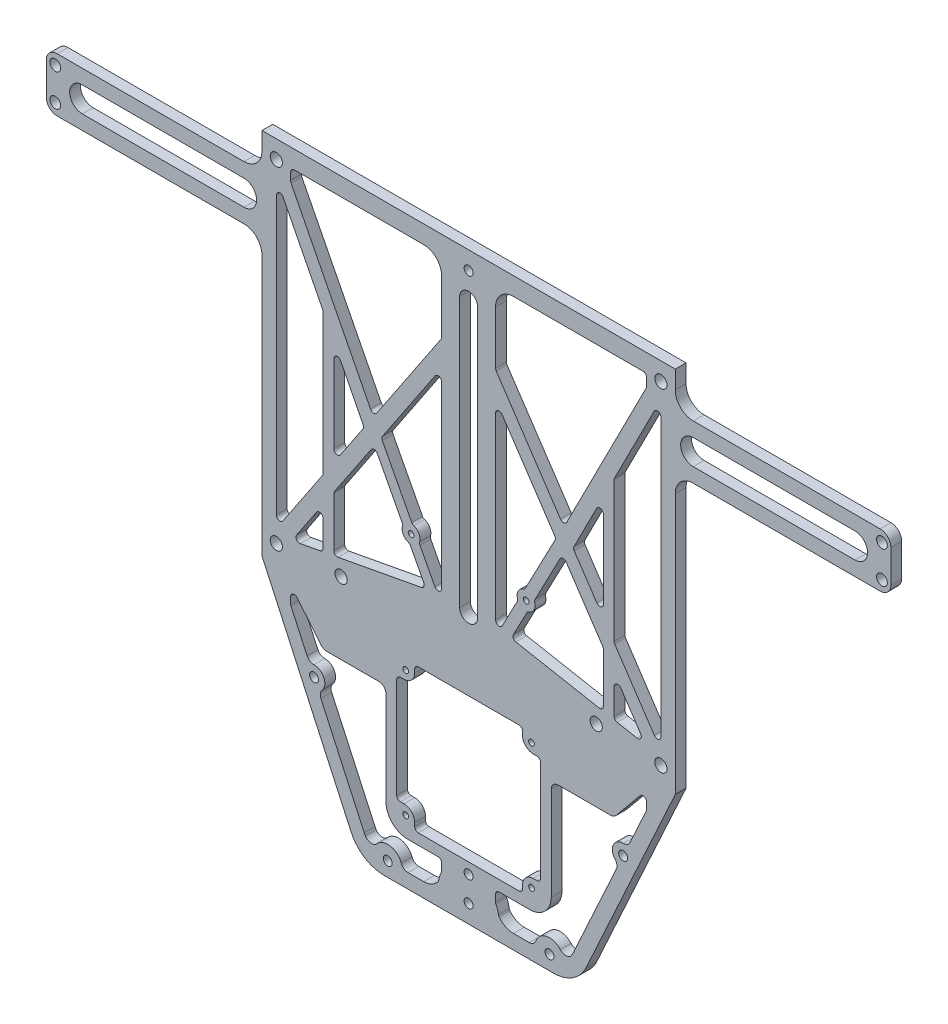
from build123d import *

# Parameters (mm, degrees)
SKETCH_1_W           = 235
SKETCH_1_H           = 15
EXTRUDE_1_DEPTH      = 3
SKETCH_2_R           = 1.4999999999999971
SKETCH_2_R_2         = 1.4999999999999827
CUT_EXTRUDE_1_DEPTH  = 118.7773322842728
FILLET_2_R           = 3
SKETCH_6_W           = 115.00000000000001
SKETCH_6_H           = 35
EXTRUDE_3_DEPTH      = 3
SKETCH_7_W           = 115.00000000000001
SKETCH_7_H           = 3.0000000000000027
EXTRUDE_4_DEPTH      = 127.5
CUT_EXTRUDE_2_DEPTH  = 187.65543120948826
HOLE_WIZARD_M3_1_D   = 3.4
FILLET_3_R           = 10
CUT_EXTRUDE_3_DEPTH  = 187.65543120948826
CUT_EXTRUDE_4_DEPTH  = 187.65543120948826
FILLET_4_R           = 5
EXTRUDE_5_DEPTH      = 3
FILLET_5_R           = 1
FILLET_6_R           = 5
EXTRUDE_START        = -3
EXTRUDE_6_DEPTH      = 3
FILLET_7_DEPTH       = 3
EXTRUDE_7_DEPTH      = 3
FILLET_8_R           = 1
SKETCH_17_R          = 4.000000000000007
EXTRUDE_8_DEPTH      = 3
FILLET_9_R           = 3
HOLE_WIZARD_M3_4_D   = 3.4
HOLE_WIZARD_M3_6_D   = 2.5
HOLE_WIZARD_M3_2_D   = 2.5
CUT_EXTRUDE_5_DEPTH  = 187.65543120948826
CUT_EXTRUDE_6_DEPTH  = 3
EXTRUDE_9_DEPTH      = 3
EXTRUDE_10_DEPTH     = 3
EXTRUDE_11_DEPTH     = 3
EXTRUDE_12_DEPTH     = 3
FILLET_10_R          = 1
CUT_EXTRUDE_7_DEPTH  = 187.65543120948826
FILLET_11_R          = 1
EXTRUDE_13_DEPTH     = 3
HOLE_WIZARD_M2_1_D   = 1.6
EXTRUDE_14_DEPTH     = 3
CUT_EXTRUDE_11_DEPTH = 3
FILLET_12_R          = 2
SKETCH_43_R          = 4.0000000000000036
EXTRUDE_15_DEPTH     = 3
FILLET_14_R          = 2
HOLE_WIZARD_M3_3_D   = 2.5
HOLE_WIZARD_M3_4_2_D = 2.5
SKETCH_48_R          = 3.0000000000000018
EXTRUDE_16_DEPTH     = 3
FILLET_15_R          = 2
HOLE_WIZARD_M3_3_2_D = 2.5
CUT_EXTRUDE_12_DEPTH = 187.65543135172896
SKETCH_52_R          = 2.499999999999999
EXTRUDE_17_DEPTH     = 3
SKETCH_52_R_2        = 2.500000000000001
EXTRUDE_17_2_DEPTH   = 3
EXTRUDE_18_DEPTH     = 3
EXTRUDE_19_DEPTH     = 3
FILLET_16_R          = 1
HOLE_WIZARD_M2_3_D   = 1.6


with BuildPart() as part:
    # ｽｹｯﾁ1 → ﾎﾞｽ - 押し出し1 (new body)
    with BuildSketch(Plane.XY):
        Rectangle(SKETCH_1_W, SKETCH_1_H)
    extrude(amount=EXTRUDE_1_DEPTH)

    # ｽｹｯﾁ2 → ｶｯﾄ - 押し出し1 (cut, through all)
    with BuildSketch(Plane.XY.offset(3)):
        with Locations((115.00000000000001, 4.500000000000041)):
            Circle(SKETCH_2_R)
        with Locations(Location((115.00000000000001, -4.500000000000043, 0), (0, 0, 180))):
            Circle(SKETCH_2_R)
        with Locations((-115.00000000000001, -4.5000000000001)):
            Circle(SKETCH_2_R)
        with Locations(Location((-115.00000000000001, 4.500000000000041, 0), (0, 0, 180))):
            Circle(SKETCH_2_R_2)
    extrude(amount=-CUT_EXTRUDE_1_DEPTH, mode=Mode.SUBTRACT)

    # ﾌｨﾚｯﾄ2
    fillet_2_edges = [part.edges().sort_by_distance(p)[0] for p in [
        (117.50000000000001, -7.500000000000001, 1.5),
        (-117.49999999999997, -7.500000000000001, 1.5),
        (-117.49999999999997, 7.499999999999999, 1.5),
        (117.50000000000001, 7.499999999999999, 1.5),
    ]]
    fillet(fillet_2_edges, radius=FILLET_2_R)

    # ｽｹｯﾁ6 → ﾎﾞｽ - 押し出し3 (add)
    with BuildSketch(Plane(origin=(0, 0, 0), x_dir=(-1, 0, 0), z_dir=(0, 0, -1))):
        Rectangle(SKETCH_6_W, SKETCH_6_H)
    extrude(amount=-EXTRUDE_3_DEPTH)

    # ｽｹｯﾁ7 → ﾎﾞｽ - 押し出し4 (add)
    with BuildSketch(Plane.XZ.offset(17.499999999999996)):
        with Locations((0, 1.5000000000000013)):
            Rectangle(SKETCH_7_W, SKETCH_7_H)
    extrude(amount=EXTRUDE_4_DEPTH)

    # ｽｹｯﾁ8 → ｶｯﾄ - 押し出し2 (cut, through all)
    with BuildSketch(Plane(origin=(0, 0, 0), x_dir=(-1, 0, 0), z_dir=(0, 0, -1))):
        Polygon((-57.5, -85.00000000000016), (-57.5, -145), (-29.99999999999998, -144.99999999999997), align=None)
        Polygon((30.00000000000002, -144.99999999999997), (57.50000000000003, -85.00000000000014), (57.5, -145), align=None)
    extrude(amount=-CUT_EXTRUDE_2_DEPTH, mode=Mode.SUBTRACT)

    # M3 すきま穴1 (through all)
    with Locations(Plane(origin=(0, 0, 0), x_dir=(-1, 0, 0), z_dir=(0, 0, -1))):
        with Locations((53.5, 12.5), (53.5, -80), (-53.5, 12.5), (-53.5, -80)):
            Hole(HOLE_WIZARD_M3_1_D / 2)

    # ﾌｨﾚｯﾄ3
    fillet_3_edges = [part.edges().sort_by_distance(p)[0] for p in [
        (29.99999999999998, -144.99999999999997, 1.5000000000000013),
        (-30.00000000000002, -144.99999999999997, 1.5000000000000013),
    ]]
    fillet(fillet_3_edges, radius=FILLET_3_R)

    # ｽｹｯﾁ12 → ｶｯﾄ - 押し出し3 (cut, through all)
    with BuildSketch(Plane.XY.offset(3)):
        with BuildLine():
            Line((49.499999999999474, 12.500000000001004), (-49.50000000000051, 12.500000000001004))
            Line((-49.50000000000051, 12.500000000001004), (-49.50000000000017, 9.500000000001))
            Line((-49.50000000000017, 9.500000000001), (-51.500000000000185, 7.5000000000010125))
            Line((-51.500000000000185, 7.5000000000010125), (-52.50000000000018, 7.50000000000102))
            ThreePointArc((-52.50000000000018, 7.50000000000102), (-53.20710678118673, 7.207106781187569), (-53.500000000000185, 6.500000000001019))
            Line((-53.500000000000185, 6.500000000001019), (-53.50000000000046, -73.99999999999895))
            ThreePointArc((-53.50000000000046, -73.99999999999895), (-53.207106781187015, -74.70710678118549), (-52.50000000000047, -74.99999999999896))
            Line((-52.50000000000047, -74.99999999999896), (-51.50000000000047, -74.99999999999896))
            Line((-51.50000000000047, -74.99999999999896), (-49.500000000000476, -76.99999999999896))
            Line((-49.500000000000476, -76.99999999999896), (-49.5000000000005, -81.99999999999896))
            Line((-49.5000000000005, -81.99999999999896), (-49.5000000000005, -92.85426997640342))
            Line((-49.5000000000005, -92.85426997640342), (-29.037406618662327, -137.49992826295926))
            ThreePointArc((-29.037406618662327, -137.49992826295926), (-26.82342123812749, -140.04973116005968), (-23.58301768129662, -141))
            Line((-23.58301768129662, -141), (23.583017681296578, -141))
            ThreePointArc((23.583017681296578, -141), (26.823421238127462, -140.0497311600597), (29.03740661866228, -137.49992826295926))
            Line((29.03740661866228, -137.49992826295926), (49.49999999999948, -92.85426997640553))
            Line((49.49999999999948, -92.85426997640553), (49.49999999999948, -82.00000000000016))
            Line((49.49999999999948, -82.00000000000016), (49.4999999999995, -77.00000000000021))
            Line((49.4999999999995, -77.00000000000021), (51.499999999999545, -75.00000000000016))
            Line((51.499999999999545, -75.00000000000016), (52.49999999999951, -75.00000000000016))
            ThreePointArc((52.49999999999951, -75.00000000000016), (53.20710678118607, -74.7071067811867), (53.49999999999952, -74.00000000000014))
            Line((53.49999999999952, -74.00000000000014), (53.4999999999998, 6.499999999999819))
            ThreePointArc((53.4999999999998, 6.499999999999819), (53.207106781186354, 7.207106781186373), (52.4999999999998, 7.499999999999826))
            Line((52.4999999999998, 7.499999999999826), (51.4999999999998, 7.499999999999826))
            Line((51.4999999999998, 7.499999999999826), (49.4999999999998, 9.499999999999828))
            Line((49.4999999999998, 9.499999999999828), (49.499999999999474, 12.500000000001004))
        make_face()
    extrude(amount=-CUT_EXTRUDE_3_DEPTH, mode=Mode.SUBTRACT)

    # ｽｹｯﾁ13 → ｶｯﾄ - 押し出し4 (cut, through all)
    with BuildSketch(Plane.XY.offset(3)):
        with BuildLine():
            Line((-107.49999999999997, 3.4999999999999982), (-62.49999999999997, 3.5000000000000093))
            ThreePointArc((-62.49999999999997, 3.5000000000000093), (-58.99999999999992, 0), (-62.49999999999997, -3.5000000000000506))
            Line((-62.49999999999997, -3.5000000000000506), (-107.49999999999997, -3.500000000000051))
            ThreePointArc((-107.49999999999997, -3.500000000000051), (-110.99999999999997, 4.3e-16), (-107.49999999999997, 3.4999999999999982))
        make_face()
        with BuildLine():
            Line((107.49999999999997, 3.500000000000025), (62.49999999999997, 3.5000000000000244))
            ThreePointArc((62.49999999999997, 3.5000000000000244), (58.99999999999992, 1.488e-14), (62.49999999999997, -3.5000000000000355))
            Line((62.49999999999997, -3.5000000000000355), (107.49999999999997, -3.500000000000025))
            ThreePointArc((107.49999999999997, -3.500000000000025), (110.99999999999997, 2.633e-14), (107.49999999999997, 3.500000000000025))
        make_face()
    extrude(amount=-CUT_EXTRUDE_4_DEPTH, mode=Mode.SUBTRACT)

    # ﾌｨﾚｯﾄ4
    fillet_4_edges = [part.edges().sort_by_distance(p)[0] for p in [
        (-57.49999999999999, 7.5, 1.5),
        (-57.5, -7.5, 1.5),
        (57.5, 7.5, 1.5),
        (57.5, -7.5, 1.5),
    ]]
    fillet(fillet_4_edges, radius=FILLET_4_R)

    # ｽｹｯﾁ14 → ﾎﾞｽ - 押し出し5 (add)
    with BuildSketch(Plane.XY.offset(3)):
        Polygon((7.4999999999999964, -141.00000000000006), (-7.500000000000002, -141.00000000000006), (-7.5, 12.500000000001004), (7.5, 12.500000000001004), align=None)
    extrude(amount=-EXTRUDE_5_DEPTH)

    # ﾌｨﾚｯﾄ5
    fillet_5_edges = [part.edges().sort_by_distance(p)[0] for p in [
        (-49.50000000000051, 12.500000000001004, 1.5),
        (49.499999999999474, 12.500000000001004, 1.5),
        (49.49999999999948, -92.85426997640553, 1.5),
        (-49.5000000000005, -92.85426997640342, 1.5),
    ]]
    fillet(fillet_5_edges, radius=FILLET_5_R)

    # ﾌｨﾚｯﾄ6
    fillet_6_edges = [part.edges().sort_by_distance(p)[0] for p in [
        (7.4999999999999964, -141.00000000000006, 1.5),
        (7.5, 12.500000000001004, 1.5),
        (-7.5, 12.500000000001004, 1.5),
        (-7.500000000000002, -141.00000000000006, 1.5),
    ]]
    fillet(fillet_6_edges, radius=FILLET_6_R)

    # ｽｹｯﾁ15 → ﾎﾞｽ - 押し出し6 (add)
    with BuildSketch(Plane(origin=(0, 0, 0), x_dir=(-1, 0, 0), z_dir=(0, 0, -1)).offset(EXTRUDE_START)):
        with BuildLine():
            Line((-7.500000000000001, -14.81273211046755), (-7.500000000000001, -7.617174431588779))
            Line((-7.500000000000017, -7.617174431588773), (-26.51644764517878, -36.05298399447322))
            Line((-26.51644764517879, -36.052983994473216), (-49.65023120787433, 9.349768792125305))
            Line((-49.65023120787433, 9.349768792125301), (-51.4999999999998, 7.499999999999826))
            Line((-51.4999999999998, 7.499999999999826), (-52.4999999999998, 7.499999999999826))
            ThreePointArc((-52.4999999999998, 7.499999999999824), (-52.81413739653952, 7.449377530856355), (-53.09646997175296, 7.3026353921903135))
            Line((-53.09646997175295, 7.302635392190315), (-29.06442984573973, -39.86305083643355))
            Line((-29.06442984573973, -39.86305083643357), (-52.561018474740614, -74.99813663680912))
            ThreePointArc((-52.5610184747406, -74.99813663680911), (-52.53052345975635, -74.999534050648), (-52.49999999999951, -75.00000000000016))
            Line((-52.49999999999951, -75.00000000000016), (-51.499999999999545, -75.00000000000016))
            Line((-51.499999999999545, -75.00000000000016), (-49.4999999999995, -77.00000000000021))
            Line((-49.4999999999995, -77.00000000000021), (-49.49999999999949, -81.2869740567545))
            Line((-49.49999999999949, -81.2869740567545), (-7.500000000000007, -73.43650676703479))
            Line((-7.499999999999999, -73.43650676703479), (-7.499999999999999, -69.3672315507223))
            Line((-7.5, -69.36723155072231), (-49.19522457219432, -77.16073147075882))
            Line((-49.19522457219433, -77.16073147075885), (-7.500000000000003, -14.812732110467548))
        make_face()
        with BuildLine():
            Line((7.5, -7.617174431588479), (7.5, -14.812732110467103))
            Line((7.499999999999999, -14.812732110467103), (49.19522457219527, -77.16073147075775))
            Line((49.19522457219527, -77.16073147075775), (7.500000000000001, -69.36723155072214))
            Line((7.500000000000001, -69.36723155072214), (7.500000000000001, -73.43650676703456))
            Line((7.499999999999998, -73.43650676703457), (49.5000000000005, -81.2869740567534))
            Line((49.5000000000005, -81.2869740567534), (49.500000000000476, -76.99999999999896))
            Line((49.500000000000476, -76.99999999999896), (51.50000000000047, -74.99999999999896))
            Line((51.50000000000047, -74.99999999999896), (52.50000000000047, -74.99999999999896))
            ThreePointArc((52.50000000000047, -74.99999999999896), (52.53052345975727, -74.9995340506468), (52.561018474741466, -74.99813663680791))
            Line((52.56101847474147, -74.99813663680791), (29.06442984574021, -39.86305083643295))
            Line((29.064429845740214, -39.86305083643295), (53.09646997175333, 7.302635392191518))
            ThreePointArc((53.096469971753336, 7.302635392191516), (52.8141373965399, 7.449377530857554), (52.50000000000018, 7.500000000001019))
            Line((52.50000000000018, 7.50000000000102), (51.500000000000185, 7.5000000000010125))
            Line((51.500000000000185, 7.5000000000010125), (49.65023120787469, 9.349768792126481))
            Line((49.65023120787469, 9.34976879212648), (26.516447645179216, -36.05298399447268))
            Line((26.516447645179223, -36.052983994472676), (7.499999999999999, -7.617174431588478))
        make_face()
        with BuildLine():
            Line((-7.4999999999999964, -135.99999999999997), (-7.4999999999999964, -132.74071751758333))
            Line((-7.500000000000014, -132.74071751758333), (-49.49999999999949, -81.71268013440607))
            Line((-49.49999999999949, -81.71268013440607), (-49.49999999999947, -88.00694603381866))
            Line((-49.49999999999947, -88.00694603381866), (-8.07770798011881, -138.33309521685158))
            ThreePointArc((-8.077707980118863, -138.3330952168516), (-7.646575430718742, -137.20177782900882), (-7.499999999999992, -135.99999999999997))
        make_face()
        with BuildLine():
            Line((49.500000000000504, -81.71268013440483), (7.499999999999977, -132.7407175175834))
            Line((7.500000000000002, -132.7407175175834), (7.500000000000002, -135.99999999999997))
            ThreePointArc((7.5, -135.99999999999997), (7.646575430718765, -137.20177782900882), (8.07770798011889, -138.33309521685158))
            Line((8.077707980118836, -138.33309521685155), (49.50000000000054, -88.00694603381736))
            Line((49.50000000000052, -88.00694603381736), (49.5000000000005, -81.71268013440485))
        make_face()
    extrude(amount=EXTRUDE_6_DEPTH)

    # ﾌｨﾚｯﾄ7: read off the stored shape, not the designer's step
    # ﾌｨﾚｯﾄ7 outline → ﾌｨﾚｯﾄ7 (add)
    with BuildSketch(Plane.XY):
        with BuildLine():
            Line((49.650231208, 9.349768792), (49.5, 9.5))
            ThreePointArc((49.5, 9.5), (49.504495078, 9.177975999), (49.406400904, 8.871223336))
            Line((49.406400904, 8.871223336), (49.650231208, 9.349768792))
        make_face()
        with BuildLine():
            Line((7.5, -7.617174432), (7.668749848, -7.869510654))
            ThreePointArc((7.668749848, -7.869510654), (7.543117, -7.604085735), (7.5, -7.313612115))
            Line((7.5, -7.313612115), (7.5, -7.617174432))
        make_face()
        with BuildLine():
            Line((26.516447645, -36.052983994), (27.290678583, -34.533465331))
            ThreePointArc((27.290678583, -34.533465331), (26.458740029, -35.07772992), (25.568421316, -34.635374531))
            Line((25.568421316, -34.635374531), (26.516447645, -36.052983994))
        make_face()
        with BuildLine():
            Line((49.5, -88.006946034), (47.72789835, -90.15996673))
            ThreePointArc((47.72789835, -90.15996673), (48.837563587, -89.854163052), (49.5, -90.79546578))
            Line((49.5, -90.79546578), (49.5, -88.006946034))
        make_face()
        with BuildLine():
            ThreePointArc((8.510632476, -139.014124543), (8.308722478, -138.390492256), (8.536404331, -137.775800584))
            Line((8.536404331, -137.775800584), (8.07770798, -138.333095217))
            ThreePointArc((8.07770798, -138.333095217), (8.280408277, -138.682358234), (8.510632476, -139.014124543))
        make_face()
        with BuildLine():
            ThreePointArc((-49.5, -90.79546578), (-48.837563587, -89.854163052), (-47.72789835, -90.15996673))
            Line((-47.72789835, -90.15996673), (-49.5, -88.006946034))
            Line((-49.5, -88.006946034), (-49.5, -90.79546578))
        make_face()
        with BuildLine():
            ThreePointArc((-8.536404331, -137.775800584), (-8.308722478, -138.390492256), (-8.510632476, -139.014124543))
            ThreePointArc((-8.510632476, -139.014124543), (-8.280408277, -138.682358234), (-8.07770798, -138.333095217))
            Line((-8.07770798, -138.333095217), (-8.536404331, -137.775800584))
        make_face()
        with BuildLine():
            ThreePointArc((-51.668749848, -73.663903177), (-52.79047362, -74.064887638), (-53.5, -73.108004638))
            Line((-53.5, -73.108004638), (-53.5, -74))
            ThreePointArc((-53.5, -74), (-53.228360651, -74.68519396), (-52.561018475, -74.998136637))
            Line((-52.561018475, -74.998136637), (-51.668749848, -73.663903177))
        make_face()
        with BuildLine():
            Line((-53.5, 6.5), (-53.5, 3.929298499))
            ThreePointArc((-53.5, 3.929298499), (-52.733444731, 4.901668571), (-51.608992885, 4.383287838))
            Line((-51.608992885, 4.383287838), (-53.096469972, 7.302635392))
            ThreePointArc((-53.096469972, 7.302635392), (-53.393439973, 6.949182606), (-53.5, 6.5))
        make_face()
        with BuildLine():
            ThreePointArc((-29.330637653, -39.340586915), (-29.22339084, -39.853644816), (-29.390394617, -40.350474794))
            Line((-29.390394617, -40.350474794), (-29.064429846, -39.863050836))
            Line((-29.064429846, -39.863050836), (-29.330637653, -39.340586915))
        make_face()
        with BuildLine():
            ThreePointArc((-7.5, -7.313612115), (-7.543117, -7.604085735), (-7.668749848, -7.869510654))
            Line((-7.668749848, -7.869510654), (-7.5, -7.617174432))
            Line((-7.5, -7.617174432), (-7.5, -7.313612115))
        make_face()
        with BuildLine():
            ThreePointArc((-25.568421316, -34.635374531), (-26.458740029, -35.07772992), (-27.290678583, -34.533465331))
            Line((-27.290678583, -34.533465331), (-26.516447645, -36.052983994))
            Line((-26.516447645, -36.052983994), (-25.568421316, -34.635374531))
        make_face()
        with BuildLine():
            ThreePointArc((-49.406400904, 8.871223336), (-49.504495078, 9.177975999), (-49.5, 9.5))
            Line((-49.5, 9.5), (-49.650231208, 9.349768792))
            Line((-49.650231208, 9.349768792), (-49.406400904, 8.871223336))
        make_face()
        with BuildLine():
            ThreePointArc((-9.331250152, -17.551050094), (-8.20952638, -17.150065633), (-7.5, -18.106948633))
            Line((-7.5, -18.106948633), (-7.5, -14.81273211))
            Line((-7.5, -14.81273211), (-9.331250152, -17.551050094))
        make_face()
        with BuildLine():
            Line((-7.5, -69.367231551), (-7.5, -68.536828634))
            ThreePointArc((-7.5, -68.536828634), (-7.730671124, -69.175681576), (-8.316266162, -69.519804665))
            Line((-8.316266162, -69.519804665), (-7.5, -69.367231551))
        make_face()
        with BuildLine():
            ThreePointArc((-46.859103021, -76.724073237), (-47.877614122, -76.291685002), (-47.87408701, -75.185198667))
            Line((-47.87408701, -75.185198667), (-49.195224572, -77.160731471))
            Line((-49.195224572, -77.160731471), (-46.859103021, -76.724073237))
        make_face()
        with BuildLine():
            ThreePointArc((-49.27210165, -81.989565981), (-49.357646749, -81.868306227), (-49.424304844, -81.735721952))
            ThreePointArc((-49.424304844, -81.735721952), (-49.130344485, -81.341061425), (-48.683733838, -81.134400942))
            Line((-48.683733838, -81.134400942), (-49.5, -81.286974057))
            Line((-49.5, -81.286974057), (-49.5, -81.712680134))
            Line((-49.5, -81.712680134), (-49.27210165, -81.989565981))
        make_face()
        with BuildLine():
            Line((-7.5, -73.436506767), (-8.683733838, -73.657765428))
            ThreePointArc((-8.683733838, -73.657765428), (-7.861147058, -73.871412583), (-7.5, -74.640741459))
            Line((-7.5, -74.640741459), (-7.5, -73.436506767))
        make_face()
        with BuildLine():
            ThreePointArc((-7.5, -129.952197772), (-8.162436413, -130.893500499), (-9.27210165, -130.587696822))
            Line((-9.27210165, -130.587696822), (-7.5, -132.740717518))
            Line((-7.5, -132.740717518), (-7.5, -129.952197772))
        make_face()
        with BuildLine():
            Line((53.096469972, 7.302635392), (51.608992885, 4.383287838))
            ThreePointArc((51.608992885, 4.383287838), (52.733444731, 4.901668571), (53.5, 3.929298499))
            Line((53.5, 3.929298499), (53.5, 6.5))
            ThreePointArc((53.5, 6.5), (53.393439973, 6.949182606), (53.096469972, 7.302635392))
        make_face()
        with BuildLine():
            ThreePointArc((29.390394617, -40.350474794), (29.22339084, -39.853644816), (29.330637653, -39.340586915))
            Line((29.330637653, -39.340586915), (29.064429846, -39.863050836))
            Line((29.064429846, -39.863050836), (29.390394617, -40.350474794))
        make_face()
        with BuildLine():
            Line((53.5, -74), (53.5, -73.108004638))
            ThreePointArc((53.5, -73.108004638), (52.79047362, -74.064887638), (51.668749848, -73.663903177))
            Line((51.668749848, -73.663903177), (52.561018475, -74.998136637))
            ThreePointArc((52.561018475, -74.998136637), (53.228360651, -74.68519396), (53.5, -74))
        make_face()
        with BuildLine():
            Line((7.5, -69.367231551), (8.316266162, -69.519804665))
            ThreePointArc((8.316266162, -69.519804665), (7.730671124, -69.175681576), (7.5, -68.536828634))
            Line((7.5, -68.536828634), (7.5, -69.367231551))
        make_face()
        with BuildLine():
            ThreePointArc((47.87408701, -75.185198667), (47.877614122, -76.291685002), (46.859103021, -76.724073237))
            Line((46.859103021, -76.724073237), (49.195224572, -77.160731471))
            Line((49.195224572, -77.160731471), (47.87408701, -75.185198667))
        make_face()
        with BuildLine():
            Line((7.5, -14.81273211), (7.5, -18.106948633))
            ThreePointArc((7.5, -18.106948633), (8.20952638, -17.150065633), (9.331250152, -17.551050094))
            Line((9.331250152, -17.551050094), (7.5, -14.81273211))
        make_face()
        with BuildLine():
            Line((7.5, -132.740717518), (9.27210165, -130.587696822))
            ThreePointArc((9.27210165, -130.587696822), (8.162436413, -130.893500499), (7.5, -129.952197772))
            Line((7.5, -129.952197772), (7.5, -132.740717518))
        make_face()
        with BuildLine():
            ThreePointArc((49.424304844, -81.735721952), (49.357646749, -81.868306227), (49.27210165, -81.989565981))
            Line((49.27210165, -81.989565981), (49.5, -81.712680134))
            Line((49.5, -81.712680134), (49.5, -81.286974057))
            Line((49.5, -81.286974057), (48.683733838, -81.134400942))
            ThreePointArc((48.683733838, -81.134400942), (49.130344485, -81.341061425), (49.424304844, -81.735721952))
        make_face()
        with BuildLine():
            Line((7.5, -73.436506767), (7.5, -74.640741459))
            ThreePointArc((7.5, -74.640741459), (7.861147058, -73.871412583), (8.683733838, -73.657765428))
            Line((8.683733838, -73.657765428), (7.5, -73.436506767))
        make_face()
    extrude(amount=FILLET_7_DEPTH)

    # ｽｹｯﾁ16 → ﾎﾞｽ - 押し出し7 (add, through all)
    with BuildSketch(Plane(origin=(0, 0, 0), x_dir=(-1, 0, 0), z_dir=(0, 0, -1))):
        Polygon((40.500000000000014, -96.29211938674199), (40.5, -8.60862890557174), (37.5, -14.496479372861534), (37.50000000000001, -96.29211938674199), align=None)
    extrude_7 = extrude(amount=-EXTRUDE_7_DEPTH)

    # ﾐﾗｰ1: ﾎﾞｽ - 押し出し7 across plane
    add(extrude_7.mirror(Plane(origin=(0, 0, 0), x_dir=(0, 0, 1), z_dir=(1, 0, 0))))

    # ﾌｨﾚｯﾄ8
    fillet_8_edges = [part.edges().sort_by_distance(p)[0] for p in [
        (-49.50000000000017, 9.500000000001, 1.5),
        (49.4999999999998, 9.499999999999828, 1.5),
        (-37.5, -52.47698751569966, 1.5),
        (-40.50000000000001, -56.962968824110774, 1.5),
        (-40.500000000000014, -92.64725957365783, 1.5),
        (-40.500000000000014, -79.60473106609929, 1.5),
        (-40.500000000000014, -75.53545584978686, 1.5),
        (-40.50000000000002, -64.15852650298942, 1.5),
        (-40.50000000000001, -17.419408477604975, 1.5),
        (-37.50000000000001, -74.97470818623552, 1.5),
        (-37.500000000000014, -59.672545194578305, 1.5),
        (-37.50000000000001, -23.30725894489484, 1.5),
        (-37.50000000000001, -79.04398340254797, 1.5),
        (-37.50000000000001, -96.29211938674199, 1.5),
        (40.50000000000001, -64.15852650299148, 1.5),
        (37.50000000000001, -59.672545194580216, 1.5),
        (37.49999999999999, -23.307258944894805, 1.5),
        (37.5, -52.47698751570141, 1.5),
        (37.50000000000001, -79.04398340254895, 1.5),
        (37.500000000000014, -74.97470818623648, 1.5),
        (40.500000000000014, -79.60473106610036, 1.5),
        (40.500000000000014, -75.53545584978787, 1.5),
        (40.500000000000014, -92.64725957365783, 1.5),
        (37.50000000000001, -96.29211938674199, 1.5),
        (40.5, -17.41940847760508, 1.5),
        (40.500000000000014, -56.96296882411268, 1.5),
    ]]
    fillet(fillet_8_edges, radius=FILLET_8_R)

    # ｽｹｯﾁ17 → ﾎﾞｽ - 押し出し8 (add)
    with BuildSketch(Plane.XY.offset(3)):
        with Locations((35.50000000000001, -78.9999999999996)):
            Circle(SKETCH_17_R)
        with Locations((-35.50000000000001, -78.9999999999996)):
            Circle(SKETCH_17_R)
    extrude(amount=-EXTRUDE_8_DEPTH)

    # ﾌｨﾚｯﾄ9
    fillet_9_edges = [part.edges().sort_by_distance(p)[0] for p in [
        (37.50000000000001, -82.46410161513737, 1.5),
        (31.640606919967794, -77.94876974272981, 1.5),
        (-37.50000000000001, -82.46410161513737, 1.5),
        (-31.640606919968008, -77.94876974272901, 1.5),
    ]]
    fillet(fillet_9_edges, radius=FILLET_9_R)

    # Hole Wizard M3 _4 (through all)
    with Locations(Plane(origin=(0, 0, 0), x_dir=(-1, 0, 0), z_dir=(0, 0, -1))):
        with Locations((-35.5, -79), (35.5, -79)):
            Hole(HOLE_WIZARD_M3_4_D / 2)

    # M3 ねじ穴6 (through all)
    with Locations(Plane(origin=(0, 0, 0), x_dir=(-1, 0, 0), z_dir=(0, 0, -1))):
        with Locations((0, 12.5)):
            Hole(HOLE_WIZARD_M3_6_D / 2)

    # M3 ねじ穴2 (through all)
    with Locations(Plane(origin=(0, 0, 0), x_dir=(-1, 0, 0), z_dir=(0, 0, -1))):
        with Locations((0, -140)):
            Hole(HOLE_WIZARD_M3_2_D / 2)

    # ｽｹｯﾁ27 → ｶｯﾄ - 押し出し5 (cut, through all)
    with BuildSketch(Plane(origin=(0, 0, 0), x_dir=(-1, 0, 0), z_dir=(0, 0, -1))):
        with BuildLine():
            ThreePointArc((8.32275982395216, -138.57953908796685), (8.342066058755638, -138.15440690092925), (8.536404331452124, -137.77580058439054))
            Line((8.536404331452127, -137.77580058439054), (43.74417865860412, -94.99999999999997))
            Line((43.74417865860416, -95), (-43.74417865860412, -95))
            Line((-43.74417865860412, -95), (-8.536404331452111, -137.7758005843906))
            ThreePointArc((-8.536404331452115, -137.7758005843906), (-8.34206605175053, -138.1544069272827), (-8.322759833127442, -138.57953914172663))
            ThreePointArc((-8.32275983312744, -138.57953914172663), (-2.726857037e-08, -131.5568939193087), (8.32275982395216, -138.57953908796685))
        make_face()
    extrude(amount=-CUT_EXTRUDE_5_DEPTH, mode=Mode.SUBTRACT)

    # ｽｹｯﾁ28 → ｶｯﾄ - 押し出し6 (cut)
    with BuildSketch(Plane(origin=(0, 0, 0), x_dir=(-1, 0, 0), z_dir=(0, 0, -1))):
        Polygon((-8.683733837516009, -73.65776542825272), (-7.24e-15, -72.03463760815623), (8.683733837515994, -73.65776542825249), (7.500000000000002, -95), (-7.4999999999999964, -95), align=None)
    extrude(amount=-CUT_EXTRUDE_6_DEPTH, mode=Mode.SUBTRACT)

    # ｽｹｯﾁ30 → ﾎﾞｽ - 押し出し9 (add)
    with BuildSketch(Plane.XY.offset(3)):
        with BuildLine():
            Line((-17, -133), (17, -133))
            ThreePointArc((17, -133), (21.242640687119287, -131.2426406871193), (23.000000000000014, -127))
            Line((23.000000000000014, -127), (23.00000000000001, -93))
            ThreePointArc((23.00000000000001, -93), (21.242640687119295, -88.75735931288071), (17.000000000000004, -87))
            Line((17.000000000000004, -87), (-16.999999999999996, -87))
            ThreePointArc((-16.999999999999996, -87), (-21.24264068711928, -88.75735931288071), (-22.999999999999996, -93))
            Line((-22.999999999999996, -93), (-22.999999999999993, -127))
            ThreePointArc((-22.999999999999993, -127), (-21.24264068711928, -131.2426406871193), (-17, -133))
        make_face()
    extrude(amount=-EXTRUDE_9_DEPTH)

    # ｽｹｯﾁ31 → ﾎﾞｽ - 押し出し10 (add)
    with BuildSketch(Plane.XY.offset(3)):
        Polygon((-7.500000000000001, -68.53682863449448), (7.499999999999998, -68.53682863449448), (7.5, -87), (-7.499999999999999, -87), align=None)
    extrude(amount=-EXTRUDE_10_DEPTH)

    # ｽｹｯﾁ32 → ﾎﾞｽ - 押し出し11 (add)
    with BuildSketch(Plane(origin=(0, 0, 0), x_dir=(-1, 0, 0), z_dir=(0, 0, -1))):
        Polygon((-43.74417865860411, -95), (-23.000000000000014, -120.20320771606117), (-23.000000000000014, -112.61682242990662), (-37.50000000000001, -95), align=None)
        Polygon((23.000000000000014, -112.61682242990662), (23.000000000000014, -120.20320771606117), (43.74417865860411, -95), (37.50000000000001, -95), align=None)
    extrude(amount=-EXTRUDE_11_DEPTH)

    # ｽｹｯﾁ33 → ﾎﾞｽ - 押し出し12 (add)
    with BuildSketch(Plane(origin=(0, 0, 0), x_dir=(-1, 0, 0), z_dir=(0, 0, -1))):
        Polygon((-7.5, -87), (7.4999999999999964, -87), (7.500000000000002, -136.12236666382628), (-7.499999999999994, -136.12236666382628), align=None)
    extrude(amount=-EXTRUDE_12_DEPTH)

    # ﾌｨﾚｯﾄ10
    fillet_10_edges = [part.edges().sort_by_distance(p)[0] for p in [
        (37.50000000000001, -95, 1.5),
        (-37.50000000000001, -95, 1.5),
        (7.5, -87, 1.5),
        (7.4999999999999964, -73.43650676703479, 1.5),
        (-7.5, -73.43650676703456, 1.5),
        (-7.499999999999999, -87, 1.5),
        (23.000000000000014, -112.61682242990662, 1.5),
        (23.000000000000014, -120.20320771606117, 1.5),
        (-23.000000000000014, -112.61682242990662, 1.5),
        (-23.000000000000014, -120.20320771606117, 1.5),
        (7.499999999999993, -133, 1.5),
        (7.499999999999994, -136.12236666382628, 1.5),
        (-7.500000000000001, -133, 1.5),
        (-7.500000000000002, -136.12236666382628, 1.5),
    ]]
    fillet(fillet_10_edges, radius=FILLET_10_R)

    # ｽｹｯﾁ34 → ｶｯﾄ - 押し出し7 (cut, through all)
    with BuildSketch(Plane(origin=(0, 0, 0), x_dir=(-1, 0, 0), z_dir=(0, 0, -1))):
        with BuildLine():
            ThreePointArc((-15.000000000000009, -128), (-15.878679656440367, -125.87867965644035), (-18.00000000000001, -125))
            Line((-18.00000000000001, -125), (-19.999999999999954, -125.00000000000003))
            Line((-19.999999999999954, -125.00000000000003), (-19.99999999999996, -95))
            Line((-19.99999999999996, -95), (-18.000000000000004, -95))
            ThreePointArc((-18.000000000000004, -95), (-15.878679656440362, -94.12132034355965), (-15.000000000000002, -92))
            Line((-15.000000000000002, -92), (-15.000000000000004, -90))
            Line((-15.000000000000004, -90), (14.999999999999996, -90))
            Line((14.999999999999996, -90), (14.999999999999995, -91.99999999999999))
            ThreePointArc((14.999999999999995, -91.99999999999999), (15.878679656440353, -94.12132034355963), (18.000000000000014, -94.99999999999994))
            Line((18.000000000000014, -94.99999999999994), (20.000000000000018, -94.99999999999994))
            Line((20.000000000000018, -94.99999999999994), (20.000000000000018, -124.99999999999994))
            Line((20.000000000000018, -124.99999999999994), (17.999999999999993, -125.00000000000003))
            ThreePointArc((17.999999999999993, -125.00000000000003), (15.878679656440369, -125.87867965644038), (15.000000000000066, -127.99999999999997))
            Line((15.000000000000066, -127.99999999999997), (15.000000000000066, -129.99999999999997))
            Line((15.000000000000066, -129.99999999999997), (-14.999999999999934, -129.99999999999997))
            Line((-14.999999999999934, -129.99999999999997), (-15.000000000000009, -128))
        make_face()
    extrude(amount=-CUT_EXTRUDE_7_DEPTH, mode=Mode.SUBTRACT)

    # ﾌｨﾚｯﾄ11
    fillet_11_edges = [part.edges().sort_by_distance(p)[0] for p in [
        (19.999999999999954, -125.00000000000003, 1.5),
        (19.99999999999996, -95, 1.5),
        (15.000000000000004, -90, 1.5),
        (-14.999999999999996, -90, 1.5),
        (-20.000000000000018, -94.99999999999994, 1.5),
        (-20.000000000000018, -124.99999999999994, 1.5),
        (-15.000000000000066, -129.99999999999997, 1.5),
        (14.999999999999934, -129.99999999999997, 1.5),
    ]]
    fillet(fillet_11_edges, radius=FILLET_11_R)

    # ｽｹｯﾁ35 → ﾎﾞｽ - 押し出し13 (add)
    with BuildSketch(Plane(origin=(0, 0, 0), x_dir=(-1, 0, 0), z_dir=(0, 0, -1)).offset(EXTRUDE_START)):
        with BuildLine():
            Line((-23.00000000000001, -93), (-23.000000000000007, -76.33370302871708))
            Line((-23.000000000000007, -76.33370302871708), (-8.683733837516009, -73.65776542825272))
            ThreePointArc((-8.683733837516009, -73.65776542825272), (-7.861147058203536, -73.87141258341141), (-7.499999999999999, -74.64074145896335))
            Line((-7.499999999999999, -74.64074145896335), (-7.5, -86))
            ThreePointArc((-7.5, -86), (-7.79289321881345, -86.70710678118655), (-8.499999999999998, -87))
            Line((-8.499999999999998, -87), (-17.000000000000004, -87))
            ThreePointArc((-17.000000000000004, -87), (-21.242640687119287, -88.75735931288071), (-23.00000000000001, -93))
        make_face()
        with BuildLine():
            Line((8.683733837515994, -73.65776542825249), (23, -76.33370302871649))
            Line((23, -76.33370302871649), (23, -93))
            ThreePointArc((23, -93), (21.242640687119284, -88.75735931288071), (16.999999999999996, -87))
            Line((16.999999999999996, -87), (8.499999999999996, -87))
            ThreePointArc((8.499999999999996, -87), (7.79289321881345, -86.70710678118655), (7.499999999999999, -86))
            Line((7.499999999999999, -86), (7.5, -74.64074145896313))
            ThreePointArc((7.5, -74.64074145896313), (7.861147058203527, -73.8714125834112), (8.683733837515994, -73.65776542825249))
        make_face()
    extrude(amount=EXTRUDE_13_DEPTH)

    # M2 ねじ穴1 (through all)
    with Locations(Plane(origin=(0, 0, 0), x_dir=(-1, 0, 0), z_dir=(0, 0, -1))):
        with Locations((17.5, -127.5), (-17.5, -127.5), (-17.5, -92.5), (17.5, -92.5)):
            Hole(HOLE_WIZARD_M2_1_D / 2)

    # ｽｹｯﾁ40 → ﾎﾞｽ - 押し出し14 (add)
    with BuildSketch(Plane(origin=(0, 0, 0), x_dir=(-1, 0, 0), z_dir=(0, 0, -1)).offset(EXTRUDE_START)):
        with BuildLine():
            Line((40.500000000000014, -80.80896575802784), (40.500000000000014, -89.85873982777669))
            ThreePointArc((40.500000000000014, -89.85873982777669), (41.162436413119394, -90.80004255528378), (42.27210164962459, -90.49423887785228))
            Line((42.27210164962459, -90.49423887785228), (49.27210164962507, -81.98956598065537))
            ThreePointArc((49.27210164962507, -81.98956598065537), (49.35764674879676, -81.8683062272882), (49.42430484408188, -81.73572195178043))
            ThreePointArc((49.42430484408188, -81.73572195178043), (49.130344484467955, -81.34106142444334), (48.68373383751649, -81.13440094227042))
            Line((48.68373383751649, -81.13440094227042), (41.68373383751602, -79.82598972731721))
            ThreePointArc((41.68373383751602, -79.82598972731721), (40.86114705820356, -80.0396368824759), (40.500000000000014, -80.80896575802784))
        make_face()
        with BuildLine():
            Line((23, -76.33370302871649), (22.999999999999996, -109.82830268402546))
            ThreePointArc((22.999999999999996, -109.82830268402546), (23.662436413119373, -110.76960541153255), (24.77210164962457, -110.46380173410107))
            Line((24.77210164962457, -110.46380173410107), (37.272101649624595, -95.27688584625051))
            ThreePointArc((37.272101649624595, -95.27688584625051), (37.44130272750711, -94.97895038305552), (37.50000000000001, -94.6413867961749))
            Line((37.50000000000001, -94.6413867961749), (37.50000000000001, -85.92820323027512))
            ThreePointArc((37.50000000000001, -85.92820323027512), (36.76778683805537, -83.96424221815118), (34.92857142857143, -82.95897327444276))
            ThreePointArc((34.92857142857143, -82.95897327444276), (32.76366307651999, -81.91761207860085), (31.585761938579733, -79.82385702553796))
            ThreePointArc((31.585761938579733, -79.82385702553796), (30.747227773579294, -78.29652592642798), (29.201284905062497, -77.49282170255981))
            Line((29.201284905062497, -77.49282170255981), (23, -76.33370302871649))
        make_face()
        with BuildLine():
            Line((-41.68373383751603, -79.82598972731829), (-48.68373383751551, -81.1344009422715))
            ThreePointArc((-48.68373383751551, -81.1344009422715), (-49.130344484466995, -81.34106142444443), (-49.42430484408091, -81.73572195178158))
            ThreePointArc((-49.42430484408091, -81.73572195178158), (-49.35764674879577, -81.86830622728941), (-49.272101649624055, -81.98956598065661))
            Line((-49.272101649624055, -81.98956598065661), (-42.27210164962459, -90.49423887785228))
            ThreePointArc((-42.27210164962459, -90.49423887785228), (-41.162436413119394, -90.80004255528377), (-40.500000000000014, -89.85873982777667))
            Line((-40.500000000000014, -89.85873982777667), (-40.50000000000002, -80.80896575802892))
            ThreePointArc((-40.50000000000002, -80.80896575802892), (-40.86114705820356, -80.03963688247698), (-41.68373383751603, -79.82598972731829))
        make_face()
        with BuildLine():
            Line((-23.000000000000007, -76.33370302871708), (-29.201284905062742, -77.4928217025606))
            ThreePointArc((-29.201284905062742, -77.4928217025606), (-30.74722777357937, -78.29652592642867), (-31.58576193857983, -79.82385702553842))
            ThreePointArc((-31.58576193857983, -79.82385702553842), (-32.76366307652016, -81.91761207860102), (-34.92857142857143, -82.95897327444276))
            ThreePointArc((-34.92857142857143, -82.95897327444276), (-36.767786838055365, -83.96424221815118), (-37.50000000000001, -85.92820323027512))
            Line((-37.50000000000001, -85.92820323027512), (-37.50000000000001, -94.6413867961749))
            ThreePointArc((-37.50000000000001, -94.6413867961749), (-37.4413027275071, -94.97895038305552), (-37.272101649624595, -95.27688584625051))
            Line((-37.272101649624595, -95.27688584625051), (-24.77210164962459, -110.46380173410104))
            ThreePointArc((-24.77210164962459, -110.46380173410104), (-23.66243641311939, -110.76960541153252), (-23.00000000000001, -109.82830268402543))
            Line((-23.00000000000001, -109.82830268402543), (-23.000000000000007, -76.33370302871708))
        make_face()
    extrude(amount=EXTRUDE_14_DEPTH)

    # ｽｹｯﾁ42 → ｶｯﾄ - 押し出し11 (cut)
    with BuildSketch(Plane(origin=(0, 0, 0), x_dir=(-1, 0, 0), z_dir=(0, 0, -1))):
        Polygon((-23.000000000000014, -127), (-23.000000000000014, -99), (-40.45187096629645, -99), align=None)
        Polygon((40.45187096629645, -98.99999999999999), (23.000000000000014, -127), (23.000000000000014, -99), align=None)
    extrude(amount=-CUT_EXTRUDE_11_DEPTH, mode=Mode.SUBTRACT)

    # ﾌｨﾚｯﾄ12
    fillet_12_edges = [part.edges().sort_by_distance(p)[0] for p in [
        (40.45187096629645, -99, 1.5),
        (23.000000000000014, -99, 1.5),
        (-23.000000000000014, -99, 1.5),
        (-40.45187096629645, -98.99999999999999, 1.5),
    ]]
    fillet(fillet_12_edges, radius=FILLET_12_R)

    # ｽｹｯﾁ43 → ﾎﾞｽ - 押し出し15 (add)
    with BuildSketch(Plane.XY.offset(3)):
        with Locations((-22.5, -141)):
            Circle(SKETCH_43_R)
        with Locations((22.5, -141)):
            Circle(SKETCH_43_R)
    extrude(amount=-EXTRUDE_15_DEPTH)

    # ﾌｨﾚｯﾄ14
    fillet_14_edges = [part.edges().sort_by_distance(p)[0] for p in [
        (-26.43450389301672, -140.2791122723778, 1.5),
        (-18.499999999999996, -141, 1.5),
        (26.43450389301672, -140.27911227237783, 1.5),
        (18.499999999999996, -141, 1.5),
    ]]
    fillet(fillet_14_edges, radius=FILLET_14_R)

    # Hole Wizard M3 _3 (through all)
    with Locations(Plane(origin=(0, 0, 0), x_dir=(-1, 0, 0), z_dir=(0, 0, -1))):
        with Locations((22.5, -141), (-22.5, -141)):
            Hole(HOLE_WIZARD_M3_3_D / 2)

    # Hole Wizard M3 _4 2 (through all)
    with Locations(Plane(origin=(0, 0, 0), x_dir=(-1, 0, 0), z_dir=(0, 0, -1))):
        with Locations((0, -133)):
            Hole(HOLE_WIZARD_M3_4_2_D / 2)

    # ｽｹｯﾁ48 → ﾎﾞｽ - 押し出し16 (add, through all)
    with BuildSketch(Plane.XY.offset(3)):
        with Locations((42.99999999999888, -107.00000000000045)):
            Circle(SKETCH_48_R)
        with Locations((-43.000000000000746, -106.99999999999974)):
            Circle(SKETCH_48_R)
    extrude(amount=-EXTRUDE_16_DEPTH)

    # ﾌｨﾚｯﾄ15
    fillet_15_edges = [part.edges().sort_by_distance(p)[0] for p in [
        (41.763720541298305, -109.73342515902623, 1.5),
        (44.263617403523774, -104.27910473235251, 1.5),
        (-44.26361740352439, -104.27910473235121, 1.5),
        (-41.76372054129892, -109.73342515902493, 1.5),
    ]]
    fillet(fillet_15_edges, radius=FILLET_15_R)

    # Hole Wizard M3 _3 2 (through all)
    with Locations(Plane.XY.offset(3)):
        with Locations((-43, -107), (43, -107)):
            Hole(HOLE_WIZARD_M3_3_2_D / 2)

    # ｽｹｯﾁ51 → ｶｯﾄ - 押し出し12 (cut, through all)
    with BuildSketch(Plane(origin=(0, 0, 0), x_dir=(-1, 0, 0), z_dir=(0, 0, -1))):
        with BuildLine():
            Line((-2.4999999999999996, -69.99999999999999), (-2.5000000000000004, 5))
            ThreePointArc((-2.5000000000000004, 5), (1.5e-16, 7.5), (2.5000000000000004, 5))
            Line((2.5000000000000004, 5), (2.4999999999999996, -69.99999999999999))
            ThreePointArc((2.4999999999999996, -69.99999999999999), (-4.6e-16, -72.49999999999999), (-2.4999999999999996, -69.99999999999999))
        make_face()
    extrude(amount=-CUT_EXTRUDE_12_DEPTH, mode=Mode.SUBTRACT)



with BuildPart() as body_2:
    # ｽｹｯﾁ52 → ﾎﾞｽ - 押し出し17 (new body)
    with BuildSketch(Plane.XY.offset(3)):
        with Locations((15.999999999999595, -59.00000000000012)):
            Circle(SKETCH_52_R)
    extrude(amount=-EXTRUDE_17_DEPTH)


with BuildPart() as body_3:
    # ｽｹｯﾁ52 → Extrude 17 2 (new body)
    with BuildSketch(Plane.XY.offset(3)):
        with Locations((-16.000000000000405, -58.9999999999999)):
            Circle(SKETCH_52_R_2)
    extrude(amount=-EXTRUDE_17_2_DEPTH)


with BuildPart() as part_1:
    add(part.part)

    add(body_2.part)  # ﾎﾞｽ - 押し出し18 merges body 2

    add(body_3.part)  # ﾎﾞｽ - 押し出し18 merges body 3
    # ｽｹｯﾁ53 → ﾎﾞｽ - 押し出し18 (add)
    with BuildSketch(Plane(origin=(0, 0, 0), x_dir=(-1, 0, 0), z_dir=(0, 0, -1))):
        with BuildLine():
            ThreePointArc((-18.257322976112157, -57.92552664923039), (-17.161174370427887, -56.78602753371684), (-15.60055601657235, -56.53211740471651))
            Line((-15.600556016572302, -56.53211740471646), (-24.303218731765092, -39.93904049441565))
            Line((-24.303218731765106, -39.93904049441565), (-26.201804880079983, -42.77804781899867))
            Line((-26.201804880079983, -42.77804781899867), (-18.25732297611224, -57.925526649230406))
        make_face()
        with BuildLine():
            Line((-11.83177293155289, -70.17690873419016), (-8.74664106826231, -69.60024857282743))
            Line((-8.746641068262306, -69.60024857282743), (-13.742677023886962, -60.074473350769814))
            ThreePointArc((-13.742677023887023, -60.07447335076983), (-14.838825629571295, -61.213972466283394), (-16.399443983426846, -61.46788259528373))
            Line((-16.399443983426888, -61.46788259528378), (-11.831772931552884, -70.17690873419016))
        make_face()
        with BuildLine():
            ThreePointArc((16.399443983427677, -61.46788259528351), (14.838825629572128, -61.21397246628319), (13.742677023887845, -60.07447335076964))
            Line((13.742677023887778, -60.07447335076964), (8.74664106826318, -69.60024857282738))
            Line((8.74664106826318, -69.60024857282738), (11.831772931553783, -70.17690873419005))
            Line((11.831772931553783, -70.17690873419005), (16.399443983427727, -61.46788259528356))
        make_face()
        with BuildLine():
            Line((24.303218731765924, -39.93904049441561), (15.600556016573128, -56.53211740471623))
            ThreePointArc((15.600556016573176, -56.53211740471628), (17.161174370428792, -56.78602753371667), (18.257322976113052, -57.92552664923035))
            Line((18.25732297611298, -57.92552664923034), (26.201804880080825, -42.7780478189986))
            Line((26.201804880080843, -42.77804781899859), (24.303218731765924, -39.9390404944156))
        make_face()
    extrude(amount=-EXTRUDE_18_DEPTH)

    # ｽｹｯﾁ54 → ﾎﾞｽ - 押し出し19 (add)
    with BuildSketch(Plane(origin=(0, 0, 0), x_dir=(-1, 0, 0), z_dir=(0, 0, -1))):
        with BuildLine():
            Line((7.500000000000001, -67.91751812719245), (7.500000000000001, -68.53682863449448))
            ThreePointArc((7.500000000000001, -68.53682863449448), (7.730671124448072, -69.17568157629096), (8.316266162484013, -69.51980466520511))
            Line((8.316266162484013, -69.51980466520511), (8.746641068263168, -69.60024857282738))
            Line((8.746641068263168, -69.60024857282738), (9.385588986513316, -68.38198787536376))
            ThreePointArc((9.385588986513316, -68.38198787536376), (8.26082327298974, -68.88849417903754), (7.500000000000001, -67.91751812719245))
        make_face()
        with BuildLine():
            Line((-8.316266162484013, -69.51980466520506), (-8.746641068263168, -69.60024857282733))
            Line((-8.746641068263168, -69.60024857282733), (-9.385588986513298, -68.38198787536376))
            ThreePointArc((-9.385588986513298, -68.38198787536376), (-8.260823272989722, -68.88849417903754), (-7.499999999999983, -67.91751812719245))
            Line((-7.499999999999983, -67.91751812719245), (-7.500000000000001, -68.53682863449443))
            ThreePointArc((-7.500000000000001, -68.53682863449443), (-7.730671124448072, -69.1756815762909), (-8.316266162484013, -69.51980466520506))
        make_face()
    extrude(amount=-EXTRUDE_19_DEPTH)

    # ﾌｨﾚｯﾄ16
    fillet_16_edges = [part_1.edges().sort_by_distance(p)[0] for p in [
        (15.600556016572327, -56.53211740471649, 1.5),
        (18.2573229761122, -57.9255266492304, 1.5),
        (26.201804880079983, -42.77804781899867, 1.5),
        (24.3032187317651, -39.93904049441565, 1.5),
        (16.399443983426867, -61.467882595283754, 1.5),
        (13.742677023886992, -60.07447335076982, 1.5),
        (11.831772931552887, -70.17690873419016, 1.5),
        (-11.831772931553783, -70.17690873419005, 1.5),
        (-16.3994439834277, -61.46788259528354, 1.5),
        (-13.742677023887811, -60.07447335076964, 1.5),
        (-18.257322976113016, -57.92552664923035, 1.5),
        (-15.600556016573151, -56.53211740471626, 1.5),
        (-24.303218731765924, -39.93904049441561, 1.5),
        (-26.201804880080836, -42.778047818998594, 1.5),
    ]]
    fillet(fillet_16_edges, radius=FILLET_16_R)

    # M2 ねじ穴3 (through all)
    with Locations(Plane.XY.offset(3)):
        with Locations((-16, -59), (16, -59)):
            Hole(HOLE_WIZARD_M2_3_D / 2)


solid = part_1.part
